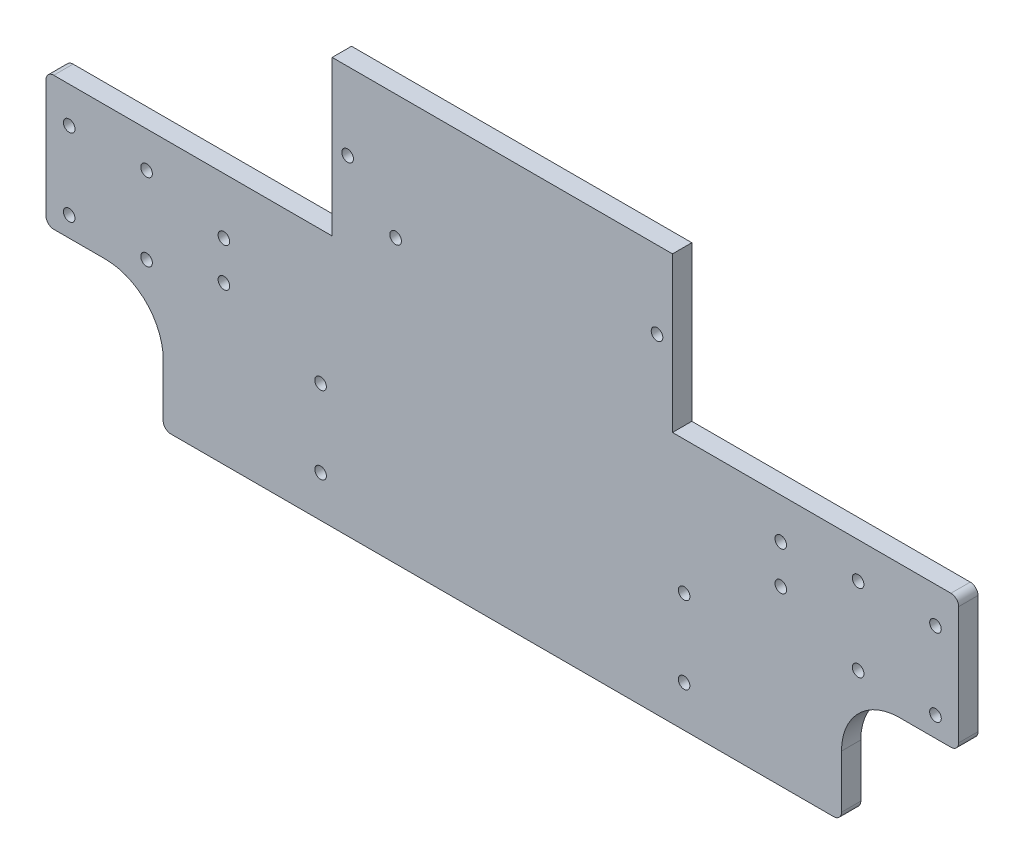
from build123d import *

# Parameters (mm, degrees)
BOSS_EXTRU_1_DEPTH      = 5
CONG_1_R                = 2
ESQUISSE2_R             = 1.5
ENL_V_MAT_EXTRU_1_DEPTH = 259.433821316
ESQUISSE3_R             = 1.5
ENL_V_MAT_EXTRU_2_DEPTH = 259.433821316
ESQUISSE4_R             = 1.5
ENL_V_MAT_EXTRU_3_DEPTH = 259.433821316


with BuildPart() as part:
    # Esquisse1 → Boss.-Extru.1 (new body)
    with BuildSketch(Plane.XY):
        with BuildLine():
            Line((30.3, 15.7), (30.3, 0))
            Line((30.3, 0), (205.7, 0))
            Line((205.7, 0), (205.7, 15.7))
            ThreePointArc((205.7, 15.7), (210.093398282, 26.306601718), (220.7, 30.7))
            Line((220.7, 30.7), (236, 30.7))
            Line((236, 30.7), (236, 65.2))
            Line((236, 65.2), (162, 65.2))
            Line((162, 65.2), (162, 105.2))
            Line((162, 105.2), (74, 105.2))
            Line((74, 105.2), (74, 65.2))
            Line((74, 65.2), (0, 65.2))
            Line((0, 65.2), (0, 30.7))
            Line((0, 30.7), (15.3, 30.7))
            ThreePointArc((15.3, 30.7), (25.906601718, 26.306601718), (30.3, 15.7))
        make_face()
    extrude(amount=BOSS_EXTRU_1_DEPTH)

    # Congé1
    cong_1_edges = [part.edges().sort_by_distance(p)[0] for p in [
        (0, 65.2, 2.5),
        (0, 30.7, 2.5),
        (30.3, 0, 2.5),
        (205.7, 0, 2.5),
        (236, 30.7, 2.5),
        (236, 65.2, 2.5),
    ]]
    fillet(cong_1_edges, radius=CONG_1_R)

    # Esquisse2 → Enlèv. mat.-Extru.1 (cut, through all)
    with BuildSketch(Plane(origin=(0, 0, 0), x_dir=(-1, 0, 0), z_dir=(0, 0, -1))):
        with Locations((-165, 30.7)):
            Circle(ESQUISSE2_R)
        with Locations((-165, 10.7)):
            Circle(ESQUISSE2_R)
        with Locations((-71, 30.7)):
            Circle(ESQUISSE2_R)
        with Locations((-71, 10.7)):
            Circle(ESQUISSE2_R)
        with Locations((-158, 85.2)):
            Circle(ESQUISSE2_R)
        with Locations((-78, 85.2)):
            Circle(ESQUISSE2_R)
        with Locations((-26, 55.9)):
            Circle(ESQUISSE2_R)
        with Locations((-26, 35.9)):
            Circle(ESQUISSE2_R)
        with Locations((-6, 35.9)):
            Circle(ESQUISSE2_R)
        with Locations((-6, 55.9)):
            Circle(ESQUISSE2_R)
        with Locations((-230, 55.9)):
            Circle(ESQUISSE2_R)
        with Locations((-230, 35.9)):
            Circle(ESQUISSE2_R)
        with Locations((-210, 35.9)):
            Circle(ESQUISSE2_R)
        with Locations((-210, 55.9)):
            Circle(ESQUISSE2_R)
    extrude(amount=-ENL_V_MAT_EXTRU_1_DEPTH, mode=Mode.SUBTRACT)

    # Esquisse3 → Enlèv. mat.-Extru.2 (cut, through all)
    with BuildSketch(Plane(origin=(0, 0, 0), x_dir=(-1, 0, 0), z_dir=(0, 0, -1))):
        with Locations((-46, 50.7)):
            Circle(ESQUISSE3_R)
        with Locations((-46, 40.7)):
            Circle(ESQUISSE3_R)
        with Locations((-190, 44.7)):
            Circle(ESQUISSE3_R)
        with Locations((-190, 54.7)):
            Circle(ESQUISSE3_R)
    extrude(amount=-ENL_V_MAT_EXTRU_2_DEPTH, mode=Mode.SUBTRACT)

    # Esquisse4 → Enlèv. mat.-Extru.3 (cut, through all)
    with BuildSketch(Plane(origin=(0, 0, 0), x_dir=(-1, 0, 0), z_dir=(0, 0, -1))):
        with Locations((-90.4, 73)):
            Circle(ESQUISSE4_R)
    extrude(amount=-ENL_V_MAT_EXTRU_3_DEPTH, mode=Mode.SUBTRACT)


solid = part.part
